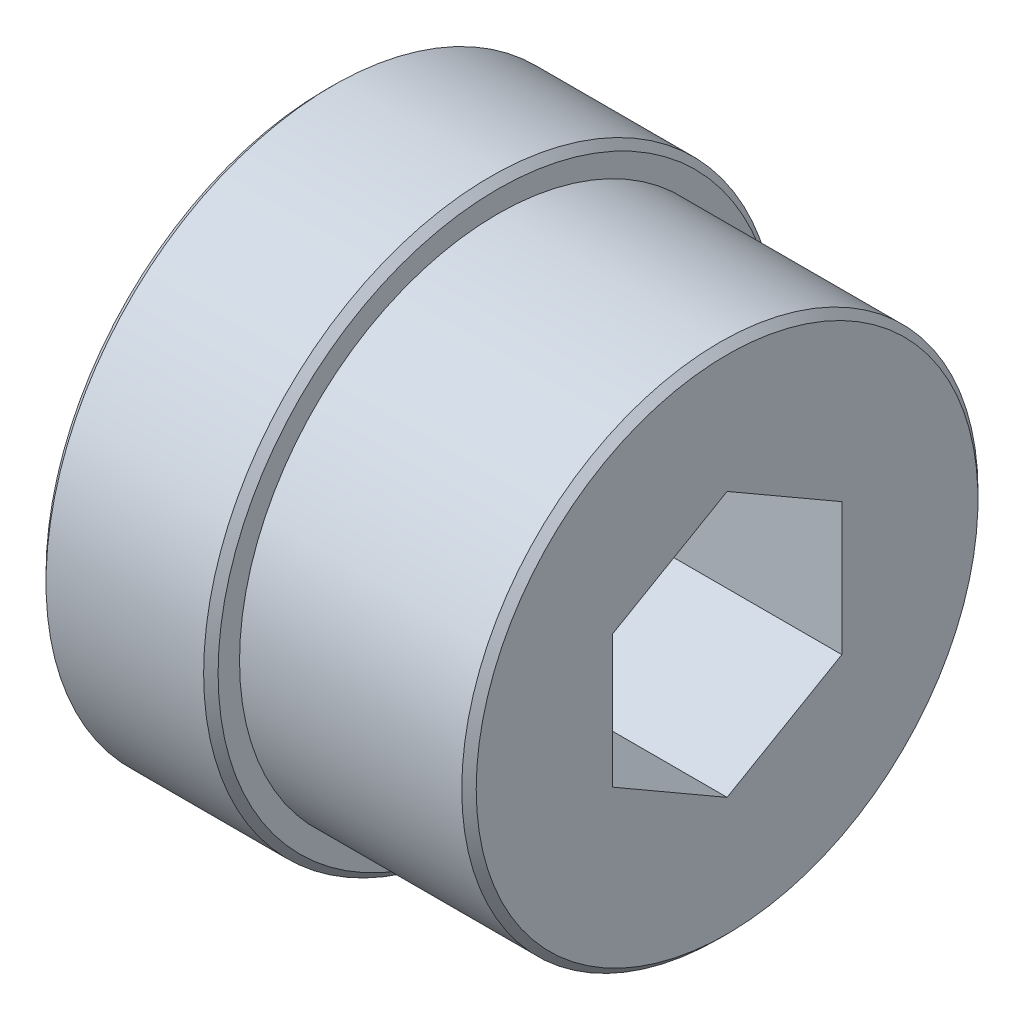
from build123d import *

# Parameters (mm, degrees)
SKETCH1_R           = 14.2875
BOSS_EXTRUDE1_DEPTH = 12.7
SKETCH2_R           = 15.875
BOSS_EXTRUDE2_DEPTH = 9.525
CHAMFER1_SIZE       = 0.4
CUT_EXTRUDE1_DEPTH  = 32.590851128


with BuildPart() as part:
    # Sketch1 → Boss-Extrude1 (new body)
    with BuildSketch(Plane(origin=(0, 0, 0), x_dir=(0, 0, -1), z_dir=(1, 0, 0))):
        Circle(SKETCH1_R)
    extrude(amount=BOSS_EXTRUDE1_DEPTH)

    # Sketch2 → Boss-Extrude2 (add)
    with BuildSketch(Plane.ZY):
        Circle(SKETCH2_R)
    extrude(amount=BOSS_EXTRUDE2_DEPTH)

    # Chamfer1
    chamfer1_edges = [part.edges().sort_by_distance(p)[0] for p in [
        (12.7, 0, 14.2875),
        (-9.525, 0, -15.875),
        (0, 0, -15.875),
    ]]
    chamfer(chamfer1_edges, length=CHAMFER1_SIZE)

    # Sketch4 → Cut-Extrude1 (cut, through all)
    with BuildSketch(Plane.ZY.offset(9.525)):
        Polygon((0, 7.332348419), (-6.35, 3.666174209), (-6.35, -3.666174209), (0, -7.332348419), (6.35, -3.666174209), (6.35, 3.666174209), align=None)
    extrude(amount=-CUT_EXTRUDE1_DEPTH, mode=Mode.SUBTRACT)


solid = part.part
